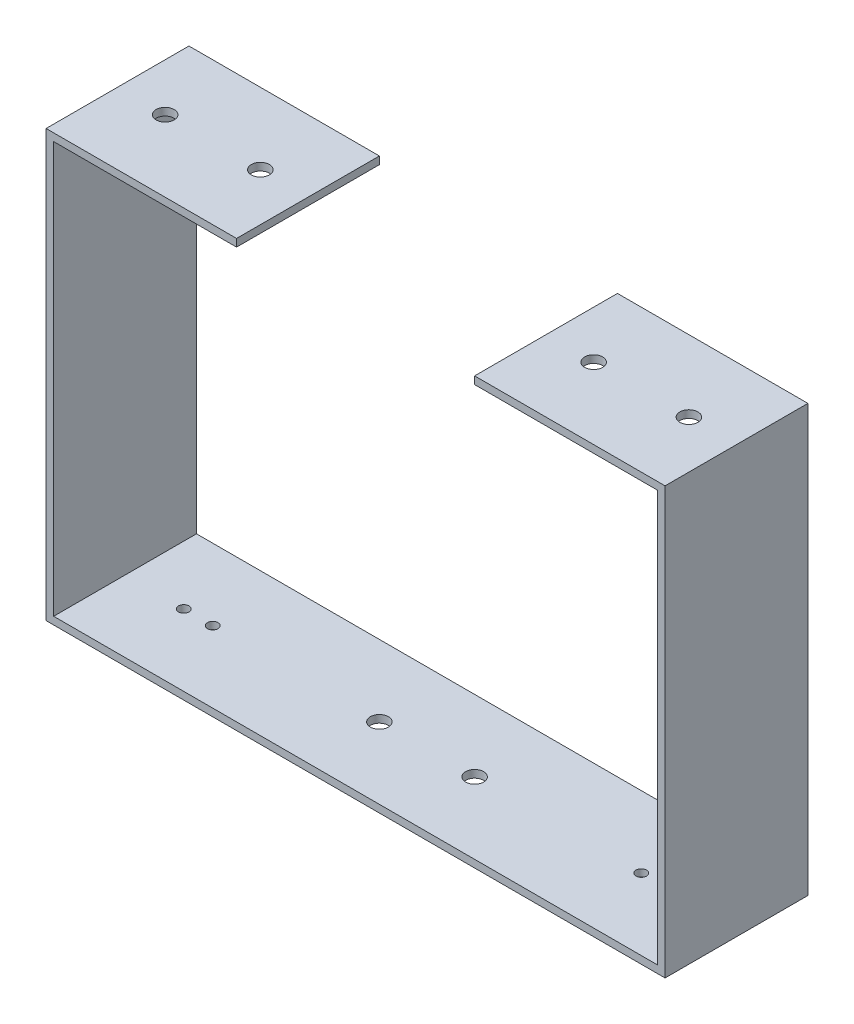
from build123d import *

# Parameters (mm, degrees)
BOSS_EXTRUDE1_DEPTH            = 15
F_2_CLEARANCE_HOLE1_AT_2_COUNT = 2
F_2_CLEARANCE_HOLE1_AT_2_PITCH = 6.096
F_6_START                      = 87.9325
F_6_CLEARANCE_HOLE1_OUTLINE_R  = 1.89865
F_6_CLEARANCE_HOLE1_DEPTH      = 1.5875
F_6_CLEARANCE_HOLE2_D          = 3.7973


# Read off the part's stored shape, not the designer's step: #6 Clearance Hole1
with BuildPart() as part:
    # Sketch1 → Boss-Extrude1 (new, symmetric)
    with BuildSketch(Plane.XY):
        Polygon((0, 0), (-65, 0), (-65, 89.52), (-25, 89.52), (-25, 87.9325), (-63.4125, 87.9325), (-63.4125, 1.5875), (0, 1.5875), align=None)
    boss_extrude1 = extrude(amount=BOSS_EXTRUDE1_DEPTH, both=True)

    # Sketch2 → #2 Clearance Hole1 (revolve, cut)
    with BuildSketch(Plane(origin=(-51.096, 0, 0), x_dir=(0, 0, -1), z_dir=(1, 0, 0))):
        Polygon((0, 0), (0, 2.252569267), (1.2192, 1.52), (1.2192, 0), align=None)
    f_2_clearance_hole1 = revolve(axis=Axis((-51.096, -6.35, 0), (0, 1, 0)), mode=Mode.SUBTRACT)

    # #2 Clearance Hole1 at 2: #2 Clearance Hole1 ×2
    with Locations(*[(i * F_2_CLEARANCE_HOLE1_AT_2_PITCH, 0, 0) for i in range(1, F_2_CLEARANCE_HOLE1_AT_2_COUNT)]):
        add(f_2_clearance_hole1, mode=Mode.SUBTRACT)

    # #6 Clearance Hole1 outline → #6 Clearance Hole1 (cut)
    with BuildSketch(Plane(origin=(0, 0, 0), x_dir=(1, 0, 0), z_dir=(0, 1, 0)).offset(F_6_START)):
        with Locations((-55, 0)):
            Circle(F_6_CLEARANCE_HOLE1_OUTLINE_R)
        with Locations((-35, 0)):
            Circle(F_6_CLEARANCE_HOLE1_OUTLINE_R)
    f_6_clearance_hole1 = extrude(amount=F_6_CLEARANCE_HOLE1_DEPTH, mode=Mode.SUBTRACT)

    # Mirror2: Boss-Extrude1, #2 Clearance Hole1, #6 Clearance Hole1 across plane
    add(boss_extrude1.mirror(Plane(origin=(0, 1.5875, -15), x_dir=(0, 0, 1), z_dir=(1, 0, 0))))
    add(f_2_clearance_hole1.mirror(Plane(origin=(0, 1.5875, -15), x_dir=(0, 0, 1), z_dir=(1, 0, 0))), mode=Mode.SUBTRACT)
    add(f_6_clearance_hole1.mirror(Plane(origin=(0, 1.5875, -15), x_dir=(0, 0, 1), z_dir=(1, 0, 0))), mode=Mode.SUBTRACT)

    # Mirror2 copy 1 sketch → Mirror2 copy 1 (revolve, cut)
    with BuildSketch(Plane(origin=(45, 0, 0), x_dir=(0, 0, -1), z_dir=(-1, 0, 0))):
        Polygon((0, 0), (0, -2.252569267), (1.2192, -1.52), (1.2192, 0), align=None)
    revolve(axis=Axis((45, -6.35, 0), (0, -1, 0)), mode=Mode.SUBTRACT)

    # #6 Clearance Hole2 (through all)
    with Locations(Plane(origin=(0, 0, 0), x_dir=(-1, 0, 0), z_dir=(0, -1, 0))):
        with Locations((-10, 0)):
            f_6_clearance_hole2 = Hole(F_6_CLEARANCE_HOLE2_D / 2)

    # Mirror3: #6 Clearance Hole2 across plane
    add(f_6_clearance_hole2.mirror(Plane(origin=(0, 0, 0), x_dir=(0, 0, 1), z_dir=(1, 0, 0))), mode=Mode.SUBTRACT)


solid = part.part
